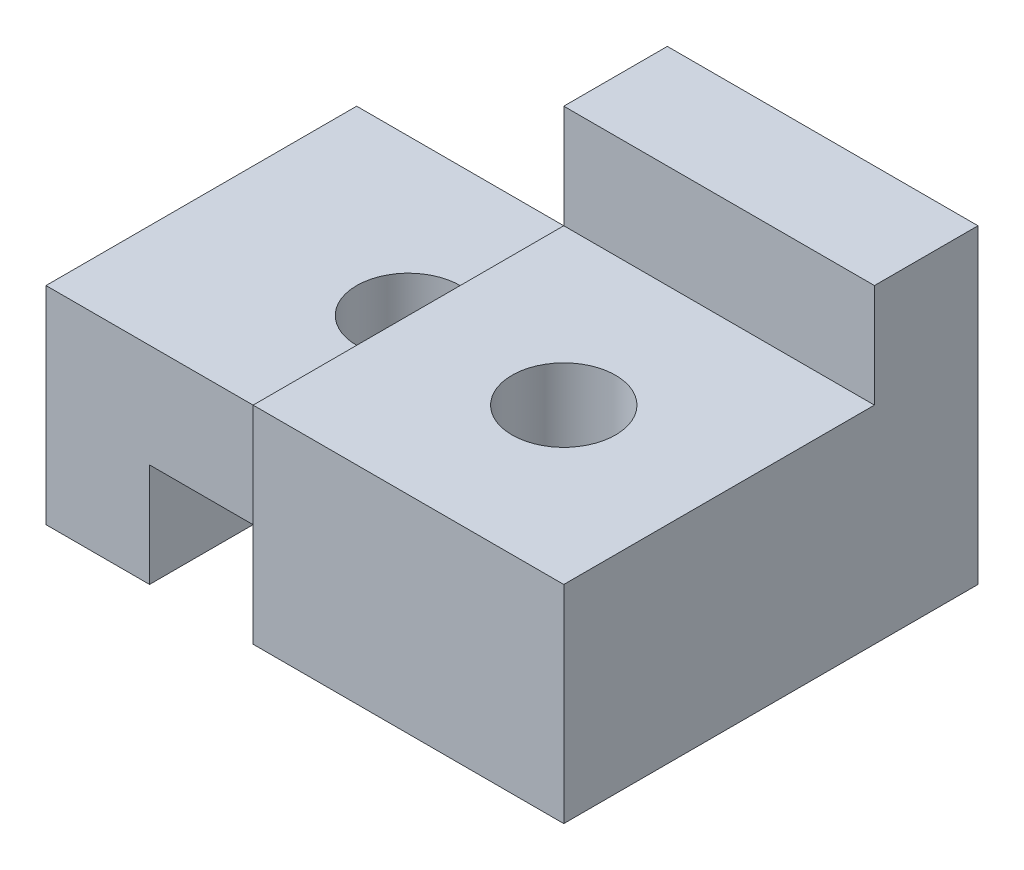
from build123d import *

# Parameters (mm, degrees)
BOSS_EXTRUDE1_DEPTH = 76.2
BOSS_EXTRUDE2_DEPTH = 101.6
SKETCH1_14_W        = 76.2
SKETCH1_14_H        = 25.4
BOSS_EXTRUDE3_DEPTH = 25.4
SKETCH3_R           = 12.7
CUT_EXTRUDE2_DEPTH  = 25.4
SKETCH4_R           = 12.7
CUT_EXTRUDE4_DEPTH  = 50.8


with BuildPart() as part:
    # Sketch1 → Boss-Extrude1 (new body)
    with BuildSketch(Plane.XY):
        Polygon((0, 50.8), (0, 0), (25.4, 0), (25.4, 25.4), (76.2, 25.4), (76.2, 50.8), align=None)
    extrude(amount=BOSS_EXTRUDE1_DEPTH)

    # Sketch1<13> → Boss-Extrude2 (add)
    with BuildSketch(Plane.XY):
        Polygon((76.2, 76.2), (76.2, 50.8), (76.2, 25.4), (152.4, 25.4), (152.4, 76.2), align=None)
    extrude(amount=BOSS_EXTRUDE2_DEPTH)

    # Sketch1<14> → Boss-Extrude3 (add)
    with BuildSketch(Plane.XY):
        with Locations((114.3, 88.9)):
            Rectangle(SKETCH1_14_W, SKETCH1_14_H)
    extrude(amount=BOSS_EXTRUDE3_DEPTH)

    # Sketch3 → Cut-Extrude2 (cut)
    with BuildSketch(Plane(origin=(0, 50.8, 0), x_dir=(1, 0, 0), z_dir=(0, 1, 0))):
        with Locations((50.8, -38.1)):
            Circle(SKETCH3_R)
    extrude(amount=-CUT_EXTRUDE2_DEPTH, mode=Mode.SUBTRACT)

    # Sketch4 → Cut-Extrude4 (cut)
    with BuildSketch(Plane(origin=(0, 76.2, 0), x_dir=(1, 0, 0), z_dir=(0, 1, 0))):
        with Locations((114.3, -63.5)):
            Circle(SKETCH4_R)
    extrude(amount=-CUT_EXTRUDE4_DEPTH, mode=Mode.SUBTRACT)


solid = part.part
